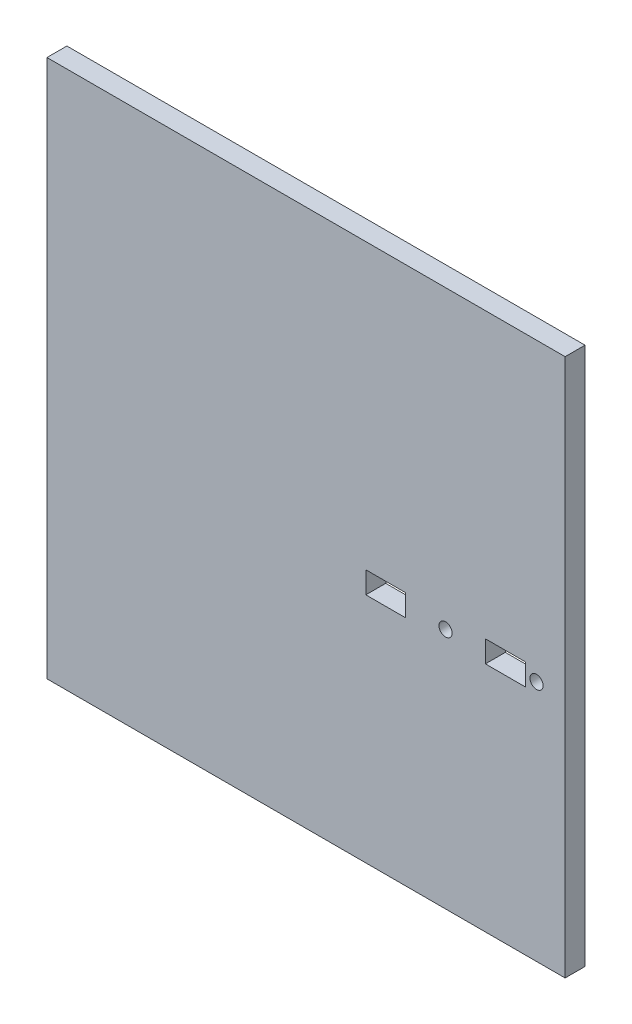
from build123d import *

# Parameters (mm, degrees)
SKETCH1_W           = 165.1
SKETCH1_H           = 171.45
BOSS_EXTRUDE1_DEPTH = 6.35
SKETCH2_W           = 12.7
SKETCH2_H           = 6.923267102
CUT_EXTRUDE1_DEPTH  = 6.35
SKETCH3_R           = 2.0955
CUT_EXTRUDE2_DEPTH  = 223.363363945


with BuildPart() as part:
    # Sketch1 → Boss-Extrude1 (new body)
    with BuildSketch(Plane.XY):
        with Locations((76.2, 69.85)):
            Rectangle(SKETCH1_W, SKETCH1_H)
    extrude(amount=BOSS_EXTRUDE1_DEPTH)

    # Sketch2 → Cut-Extrude1 (cut)
    with BuildSketch(Plane.XY.offset(6.35)):
        with Locations((101.6, 61.564133551)):
            Rectangle(SKETCH2_W, SKETCH2_H)
        with Locations((139.7, 61.564133551)):
            Rectangle(SKETCH2_W, SKETCH2_H)
    extrude(amount=-CUT_EXTRUDE1_DEPTH, mode=Mode.SUBTRACT)

    # Sketch3 → Cut-Extrude2 (cut, through all)
    with BuildSketch(Plane.XY.offset(6.35)):
        with Locations((120.65, 61.2775)):
            Circle(SKETCH3_R)
        with Locations((149.632134463, 61.2775)):
            Circle(SKETCH3_R)
    extrude(amount=-CUT_EXTRUDE2_DEPTH, mode=Mode.SUBTRACT)


solid = part.part
